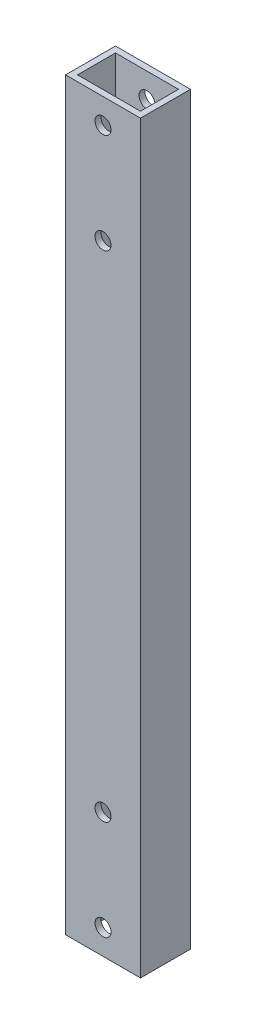
from build123d import *

# Parameters (mm, degrees)
SKETCH_1_W          = 15
SKETCH_1_H          = 10
SKETCH_1_W_2        = 12.6
SKETCH_1_H_2        = 7.6
EXTRUDE_1_DEPTH     = 74.51
SKETCH_3_R          = 1.6
CUT_EXTRUDE_1_DEPTH = 10


with BuildPart() as part:
    # ｽｹｯﾁ1 → ﾎﾞｽ - 押し出し1 (new, symmetric)
    with BuildSketch(Plane(origin=(0, 0, 0), x_dir=(1, 0, 0), z_dir=(0, 1, 0))):
        Rectangle(SKETCH_1_W, SKETCH_1_H)
        Rectangle(SKETCH_1_W_2, SKETCH_1_H_2, mode=Mode.SUBTRACT)
    extrude(amount=EXTRUDE_1_DEPTH, both=True)

    # ｽｹｯﾁ3 → ｶｯﾄ - 押し出し1 (cut)
    with BuildSketch(Plane.XY.offset(5)):
        with Locations((0, 49.51)):
            Circle(SKETCH_3_R)
        with Locations((0, 69.51)):
            Circle(SKETCH_3_R)
    cut_extrude_1 = extrude(amount=-CUT_EXTRUDE_1_DEPTH, mode=Mode.SUBTRACT)

    # ﾐﾗｰ1: ｶｯﾄ - 押し出し1 across plane
    add(cut_extrude_1.mirror(Plane.ZX), mode=Mode.SUBTRACT)


solid = part.part
